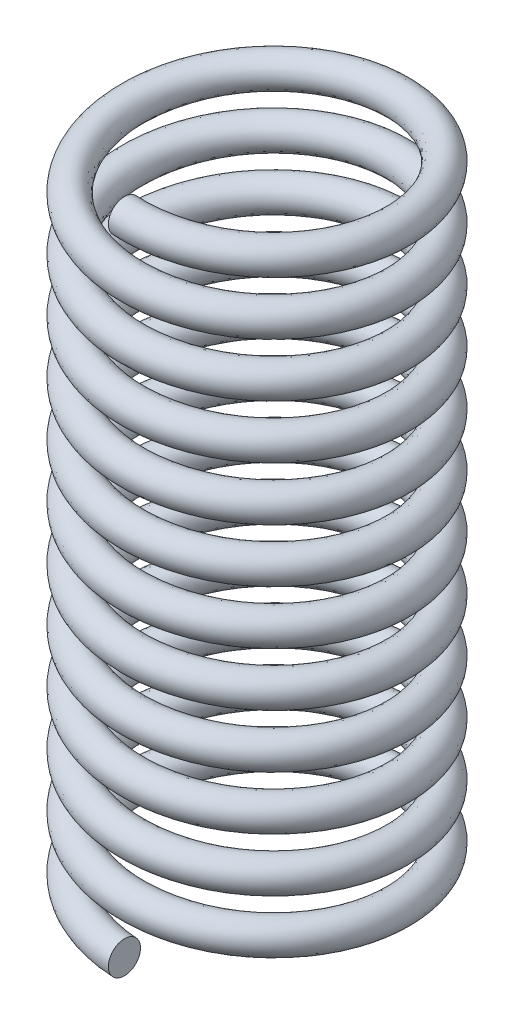
from build123d import *

# Parameters (mm, degrees)
SWEEP1_PITCH  = 1.333333333
SWEEP1_HEIGHT = 16
SWEEP1_RADIUS = 3.3
SKETCH1_R     = 0.4


with BuildPart() as part:
    # Sweep1: sweep along a helix
    with BuildLine() as sweep1_path:
        Helix(SWEEP1_PITCH, SWEEP1_HEIGHT, SWEEP1_RADIUS, center=(0, 0, -3.3), direction=(0, 1, 0), lefthand=True)
    # Sketch1 → Sweep1 (sweep)
    with BuildSketch(Plane(origin=(0, 0, 0), x_dir=(0, 0, -1), z_dir=(1, 0, 0))):
        Circle(SKETCH1_R)
    sweep(path=sweep1_path.line, is_frenet=True)


solid = part.part
